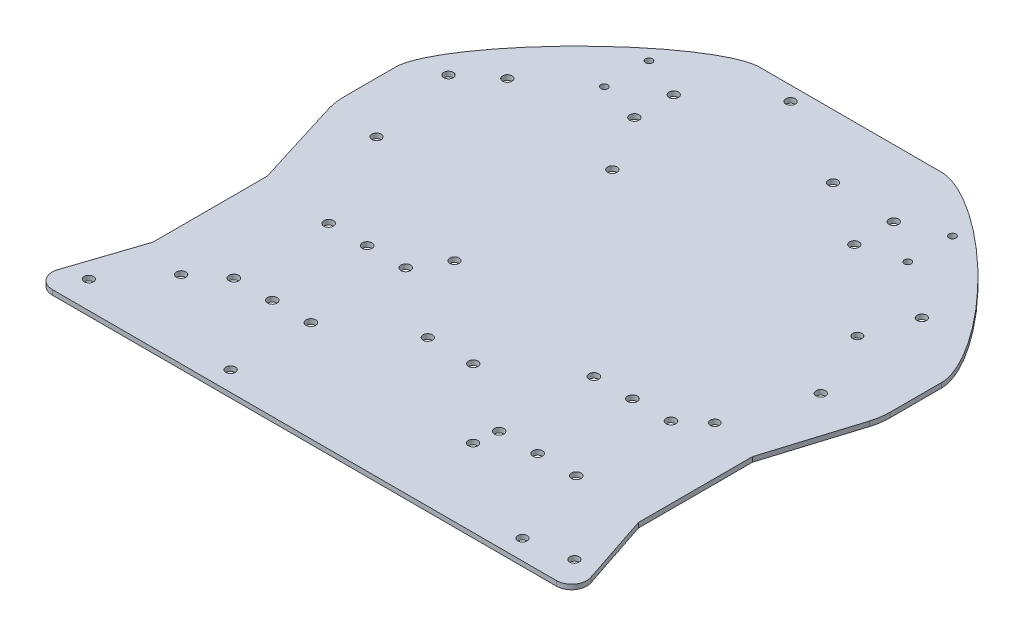
from build123d import *

# Parameters (mm, degrees)
SKETCH1_W           = 80
SKETCH1_H           = 30
SKETCH1_W_2         = 50
BOSS_EXTRUDE1_DEPTH = 1.6
FILLET1_SIZE        = 60
SKETCH6_W           = 80
SKETCH6_H           = 30
CUT_EXTRUDE1_DEPTH  = 10
FILLET2_R           = 5
FILLET3_R           = 20
SKETCH8_R           = 1.55
SKETCH8_R_2         = 1.5875
SKETCH8_R_3         = 1.5
CUT_EXTRUDE2_DEPTH  = 1.6
CUT_EXTRUDE3_REACH  = 256.563
SKETCH9_R           = 1.55
SKETCH9_R_2         = 1.143


with BuildPart() as part:
    # Sketch1 → Boss-Extrude1 (new body)
    with BuildSketch(Plane(origin=(0, 0, 0), x_dir=(1, 0, 0), z_dir=(0, 1, 0))):
        with Locations((-90, -15)):
            Rectangle(SKETCH1_W, SKETCH1_H)
        Polygon((0, 180), (-180, 180), (-180, 30), (-130, 30), (-50, 30), (0, 30), align=None)
        with Locations((-25, 15)):
            Rectangle(SKETCH1_W_2, SKETCH1_H)
        with Locations((-155, 15)):
            Rectangle(SKETCH1_W_2, SKETCH1_H)
        with Locations((-90, 15)):
            Rectangle(SKETCH1_W, SKETCH1_H)
    extrude(amount=BOSS_EXTRUDE1_DEPTH)

    # Fillet1
    # a fillet whose section is not a circle: 60 mm, written as the material it takes off along each edge
    with BuildSketch(Plane(origin=(0, -150, -180), x_dir=(0, 0, 1), z_dir=(0, 1, 0)), Plane(origin=(-180, -150, -180), x_dir=(1, 0, 0), z_dir=(0, 1, 0))) as fillet1_piece_1:
        with BuildLine():
            Bezier((FILLET1_SIZE, 0), (0, 0), (0, -FILLET1_SIZE), weights=[1, 0.25, 1])
            Line((0, -FILLET1_SIZE), (0, 0))
            Line((0, 0), (FILLET1_SIZE, 0))
        make_face()
    extrude(amount=301.6, mode=Mode.SUBTRACT)

    # Sketch6 → Cut-Extrude1 (cut)
    with BuildSketch(Plane(origin=(0, 1.6, 0), x_dir=(1, 0, 0), z_dir=(0, 1, 0))):
        with Locations((-90, -15)):
            Rectangle(SKETCH6_W, SKETCH6_H)
        Polygon((-180, 100), (-180, 0), (-170, 30.1112758), (-170, 67.7112758), align=None)
        Polygon((-10, 30.1112758), (0, 0), (0, 100), (-10, 67.7112758), align=None)
    extrude(amount=-CUT_EXTRUDE1_DEPTH, mode=Mode.SUBTRACT)

    # Fillet2
    fillet2_edges = [part.edges().sort_by_distance(p)[0] for p in [
        (-180, 0.8, 0),
        (0, 0.8, 0),
    ]]
    fillet(fillet2_edges, radius=FILLET2_R)

    # Fillet3
    fillet3_edges = [part.edges().sort_by_distance(p)[0] for p in [
        (0, 0.8, -100),
        (-180, 0.8, -100),
    ]]
    fillet(fillet3_edges, radius=FILLET3_R)

    # Sketch8 → Cut-Extrude2 (cut)
    with BuildSketch(Plane(origin=(0, 1.6, 0), x_dir=(1, 0, 0), z_dir=(0, 1, 0))):
        with Locations(Location((-105.104964584, 175.33109831, 0), (0, 0, 270))):
            Circle(SKETCH8_R)
        with Locations(Location((-74.900170028, 159.13122779, 0), (0, 0, 270))):
            Circle(SKETCH8_R)
        with Locations(Location((-115, 74.5, 0), (0, 0, 270))):
            Circle(SKETCH8_R)
        with Locations(Location((-115, 126.5, 0), (0, 0, 270))):
            Circle(SKETCH8_R)
        with Locations(Location((-146.4125, 64.417, 0), (0, 0, 270))):
            Circle(SKETCH8_R_2)
        with Locations(Location((-133.7125, 64.417, 0), (0, 0, 270))):
            Circle(SKETCH8_R_2)
        with Locations(Location((-121.0125, 64.417, 0), (0, 0, 270))):
            Circle(SKETCH8_R_2)
        with Locations(Location((-146.4125, 33.175, 0), (0, 0, 270))):
            Circle(SKETCH8_R_2)
        with Locations(Location((-133.7125, 33.175, 0), (0, 0, 270))):
            Circle(SKETCH8_R_2)
        with Locations(Location((-121.0125, 33.175, 0), (0, 0, 270))):
            Circle(SKETCH8_R_2)
        with Locations(Location((-58.9875, 64.417, 0), (0, 0, 270))):
            Circle(SKETCH8_R_2)
        with Locations(Location((-46.2875, 64.417, 0), (0, 0, 270))):
            Circle(SKETCH8_R_2)
        with Locations(Location((-33.5875, 64.417, 0), (0, 0, 270))):
            Circle(SKETCH8_R_2)
        with Locations(Location((-33.5875, 33.175, 0), (0, 0, 270))):
            Circle(SKETCH8_R_2)
        with Locations(Location((-46.2875, 33.175, 0), (0, 0, 270))):
            Circle(SKETCH8_R_2)
        with Locations(Location((-58.9875, 33.175, 0), (0, 0, 270))):
            Circle(SKETCH8_R_2)
        with Locations(Location((-59.9, 25.5, 0), (0, 0, 270))):
            Circle(SKETCH8_R)
        with Locations(Location((-24.6, 6.5, 0), (0, 0, 270))):
            Circle(SKETCH8_R)
        with Locations(Location((-120.8, 6.5, 0), (0, 0, 270))):
            Circle(SKETCH8_R)
        with Locations(Location((-156.1, 25.5, 0), (0, 0, 270))):
            Circle(SKETCH8_R)
        with Locations(Location((-27.14, 119.392, 0), (0, 0, 270))):
            Circle(SKETCH8_R_3)
        with Locations(Location((-25.87, 71.132, 0), (0, 0, 270))):
            Circle(SKETCH8_R_3)
        with Locations(Location((-169, 126.5, 0), (0, 0, 270))):
            Circle(SKETCH8_R)
        with Locations(Location((-126.25, 145, 0), (0, 0, 270))):
            Circle(SKETCH8_R)
        with Locations(Location((-53.75, 145, 0), (0, 0, 270))):
            Circle(SKETCH8_R)
        with Locations(Location((-170, 9, 0), (0, 0, 270))):
            Circle(SKETCH8_R)
        with Locations(Location((-10, 9, 0), (0, 0, 270))):
            Circle(SKETCH8_R)
    extrude(amount=-CUT_EXTRUDE2_DEPTH, mode=Mode.SUBTRACT)

    # Sketch9 → Cut-Extrude3 (cut, up to next)
    with BuildSketch(Plane.XZ, mode=Mode.PRIVATE) as cut_extrude3_sk1:
        with Locations(Location((-163.2, -97, 0), (0, 0, 270))):
            Circle(SKETCH9_R)
    cut_extrude3_tool1 = extrude(cut_extrude3_sk1.sketch, amount=-CUT_EXTRUDE3_REACH, mode=Mode.PRIVATE) & part.part
    # Sketch9 → Cut-Extrude3 (cut, up to next)
    with BuildSketch(Plane.XZ, mode=Mode.PRIVATE) as cut_extrude3_sk2:
        with Locations(Location((-158.3, -135.2, 0), (0, 0, 270))):
            Circle(SKETCH9_R)
    cut_extrude3_tool2 = extrude(cut_extrude3_sk2.sketch, amount=-CUT_EXTRUDE3_REACH, mode=Mode.PRIVATE) & part.part
    # Sketch9 → Cut-Extrude3 (cut, up to next)
    with BuildSketch(Plane.XZ, mode=Mode.PRIVATE) as cut_extrude3_sk3:
        with Locations(Location((-126.25, -158, 0), (0, 0, 270))):
            Circle(SKETCH9_R)
    cut_extrude3_tool3 = extrude(cut_extrude3_sk3.sketch, amount=-CUT_EXTRUDE3_REACH, mode=Mode.PRIVATE) & part.part
    # Sketch9 → Cut-Extrude3 (cut, up to next)
    with BuildSketch(Plane.XZ, mode=Mode.PRIVATE) as cut_extrude3_sk4:
        with Locations(Location((-53.75, -158, 0), (0, 0, 270))):
            Circle(SKETCH9_R)
    cut_extrude3_tool4 = extrude(cut_extrude3_sk4.sketch, amount=-CUT_EXTRUDE3_REACH, mode=Mode.PRIVATE) & part.part
    # Sketch9 → Cut-Extrude3 (cut, up to next)
    with BuildSketch(Plane.XZ, mode=Mode.PRIVATE) as cut_extrude3_sk5:
        with Locations(Location((-21.7, -135.2, 0), (0, 0, 270))):
            Circle(SKETCH9_R)
    cut_extrude3_tool5 = extrude(cut_extrude3_sk5.sketch, amount=-CUT_EXTRUDE3_REACH, mode=Mode.PRIVATE) & part.part
    # Sketch9 → Cut-Extrude3 (cut, up to next)
    with BuildSketch(Plane.XZ, mode=Mode.PRIVATE) as cut_extrude3_sk6:
        with Locations(Location((-16.8, -97, 0), (0, 0, 270))):
            Circle(SKETCH9_R)
    cut_extrude3_tool6 = extrude(cut_extrude3_sk6.sketch, amount=-CUT_EXTRUDE3_REACH, mode=Mode.PRIVATE) & part.part
    # Sketch9 → Cut-Extrude3 (cut, up to next)
    with BuildSketch(Plane.XZ, mode=Mode.PRIVATE) as cut_extrude3_sk7:
        with Locations(Location((-140, -148.857, 0), (0, 0, 270))):
            Circle(SKETCH9_R_2)
    cut_extrude3_tool7 = extrude(cut_extrude3_sk7.sketch, amount=-CUT_EXTRUDE3_REACH, mode=Mode.PRIVATE) & part.part
    # Sketch9 → Cut-Extrude3 (cut, up to next)
    with BuildSketch(Plane.XZ, mode=Mode.PRIVATE) as cut_extrude3_sk8:
        with Locations(Location((-140, -163.589, 0), (0, 0, 270))):
            Circle(SKETCH9_R_2)
    cut_extrude3_tool8 = extrude(cut_extrude3_sk8.sketch, amount=-CUT_EXTRUDE3_REACH, mode=Mode.PRIVATE) & part.part
    # Sketch9 → Cut-Extrude3 (cut, up to next)
    with BuildSketch(Plane.XZ, mode=Mode.PRIVATE) as cut_extrude3_sk9:
        with Locations(Location((-40, -148.857003255, 0), (0, 0, 270))):
            Circle(SKETCH9_R_2)
    cut_extrude3_tool9 = extrude(cut_extrude3_sk9.sketch, amount=-CUT_EXTRUDE3_REACH, mode=Mode.PRIVATE) & part.part
    # Sketch9 → Cut-Extrude3 (cut, up to next)
    with BuildSketch(Plane.XZ, mode=Mode.PRIVATE) as cut_extrude3_sk10:
        with Locations(Location((-40, -163.589003255, 0), (0, 0, 270))):
            Circle(SKETCH9_R_2)
    cut_extrude3_tool10 = extrude(cut_extrude3_sk10.sketch, amount=-CUT_EXTRUDE3_REACH, mode=Mode.PRIVATE) & part.part
    # Sketch9 → Cut-Extrude3 (cut, up to next)
    with BuildSketch(Plane.XZ, mode=Mode.PRIVATE) as cut_extrude3_sk11:
        with Locations(Location((-97.5, -48.175, 0), (0, 0, 270))):
            Circle(SKETCH9_R)
    cut_extrude3_tool11 = extrude(cut_extrude3_sk11.sketch, amount=-CUT_EXTRUDE3_REACH, mode=Mode.PRIVATE) & part.part
    # Sketch9 → Cut-Extrude3 (cut, up to next)
    with BuildSketch(Plane.XZ, mode=Mode.PRIVATE) as cut_extrude3_sk12:
        with Locations(Location((-82.5, -48.175, 0), (0, 0, 270))):
            Circle(SKETCH9_R)
    cut_extrude3_tool12 = extrude(cut_extrude3_sk12.sketch, amount=-CUT_EXTRUDE3_REACH, mode=Mode.PRIVATE) & part.part
    add(cut_extrude3_tool1.solids().sort_by_distance((-163.2, 0, -97))[0], mode=Mode.SUBTRACT)
    add(cut_extrude3_tool2.solids().sort_by_distance((-158.3, 0, -135.2))[0], mode=Mode.SUBTRACT)
    add(cut_extrude3_tool3.solids().sort_by_distance((-126.25, 0, -158))[0], mode=Mode.SUBTRACT)
    add(cut_extrude3_tool4.solids().sort_by_distance((-53.75, 0, -158))[0], mode=Mode.SUBTRACT)
    add(cut_extrude3_tool5.solids().sort_by_distance((-21.7, 0, -135.2))[0], mode=Mode.SUBTRACT)
    add(cut_extrude3_tool6.solids().sort_by_distance((-16.8, 0, -97))[0], mode=Mode.SUBTRACT)
    add(cut_extrude3_tool7.solids().sort_by_distance((-140, 0, -148.857))[0], mode=Mode.SUBTRACT)
    add(cut_extrude3_tool8.solids().sort_by_distance((-140, 0, -163.589))[0], mode=Mode.SUBTRACT)
    add(cut_extrude3_tool9.solids().sort_by_distance((-40, 0, -148.857003))[0], mode=Mode.SUBTRACT)
    add(cut_extrude3_tool10.solids().sort_by_distance((-40, 0, -163.589003))[0], mode=Mode.SUBTRACT)
    add(cut_extrude3_tool11.solids().sort_by_distance((-97.5, 0, -48.175))[0], mode=Mode.SUBTRACT)
    add(cut_extrude3_tool12.solids().sort_by_distance((-82.5, 0, -48.175))[0], mode=Mode.SUBTRACT)


solid = part.part
